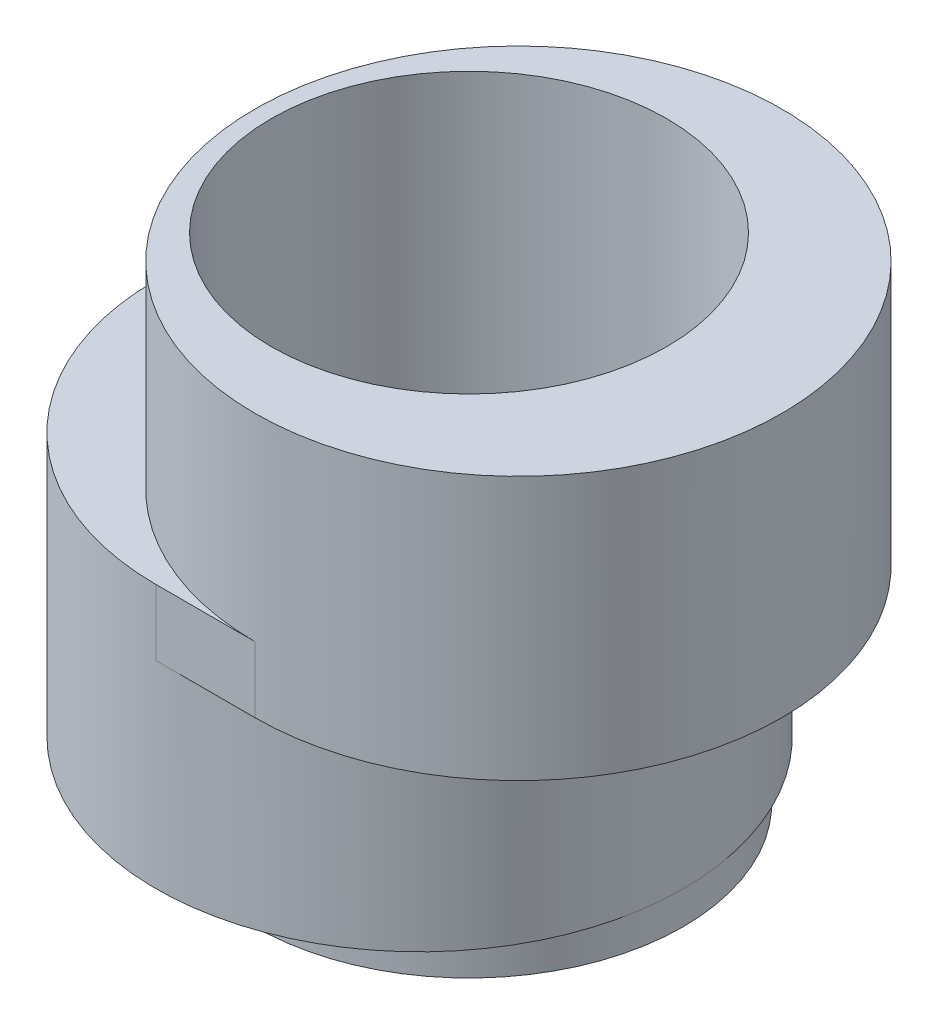
from build123d import *
from build123d.topology import SkipClean

# Parameters (mm, degrees)
SKETCH_1_R      = 4
SKETCH_1_R_2    = 3
EXTRUDE_1_DEPTH = 3
SKETCH_2_R      = 3
EXTRUDE_2_DEPTH = 1
SKETCH_3_R      = 4
SKETCH_3_R_2    = 3
EXTRUDE_3_DEPTH = 3
EXTRUDE_START   = 0.5
SKETCH_4_R      = 3.25
SKETCH_4_R_2    = 3
EXTRUDE_4_DEPTH = 0.5


with BuildPart() as part:
    # 草图1 → 凸台-拉伸1 (new body)
    with BuildSketch(Plane(origin=(0, 0, 0), x_dir=(1, 0, 0), z_dir=(0, 1, 0))):
        with Locations((-0.75, 0)):
            Circle(SKETCH_1_R)
        Circle(SKETCH_1_R_2, mode=Mode.SUBTRACT)
    extrude(amount=EXTRUDE_1_DEPTH)

    # 草图2 → 凸台-拉伸2 (add)
    with BuildSketch(Plane(origin=(0, 3, 0), x_dir=(1, 0, 0), z_dir=(0, 1, 0))):
        with BuildLine():
            Line((-0.75, 4), (0.75, 4))
            ThreePointArc((0.75, 4), (4.75, 0), (0.75, -4))
            Line((0.75, -4), (-0.75, -4))
            ThreePointArc((-0.75, -4), (-4.75, 0), (-0.75, 4))
        make_face()
        Circle(SKETCH_2_R, mode=Mode.SUBTRACT)
    extrude(amount=EXTRUDE_2_DEPTH)

    # 草图3 → 凸台-拉伸3 (add)
    with SkipClean():  # the faces are left unmerged after this step: merging them gives an invalid solid
        with BuildSketch(Plane(origin=(0, 4, 0), x_dir=(1, 0, 0), z_dir=(0, 1, 0))):
            with Locations((0.75, 0)):
                Circle(SKETCH_3_R)
            Circle(SKETCH_3_R_2, mode=Mode.SUBTRACT)
        extrude(amount=EXTRUDE_3_DEPTH)
    add(part.part.scale(1), mode=Mode.REPLACE)  # the faces are merged on a copy

    # 草图4 → 凸台-拉伸4 (add)
    with BuildSketch(Plane.XZ.offset(EXTRUDE_START)):
        Circle(SKETCH_4_R)
        Circle(SKETCH_4_R_2, mode=Mode.SUBTRACT)
    extrude(amount=-EXTRUDE_4_DEPTH)


solid = part.part
